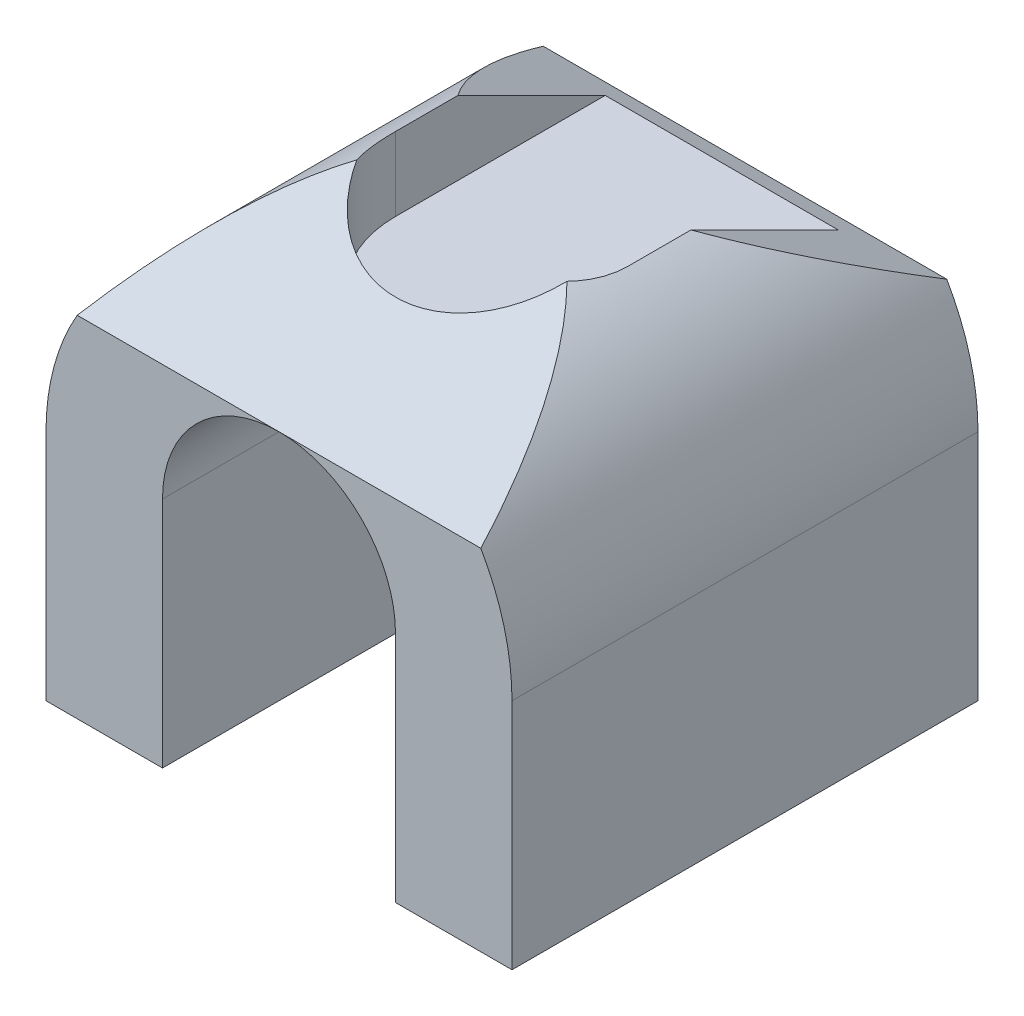
from build123d import *

# Parameters (mm, degrees)
SKETCH1_W           = 4
SKETCH1_H           = 4
BOSS_EXTRUDE1_DEPTH = 4
CUT_EXTRUDE1_DEPTH  = 10
CUT_EXTRUDE2_DEPTH  = 10
CUT_EXTRUDE5_DEPTH  = 0.9


with BuildPart() as part:
    # Sketch1 → Boss-Extrude1 (new body)
    with BuildSketch(Plane(origin=(0, 0, 0), x_dir=(1, 0, 0), z_dir=(0, 1, 0))):
        Rectangle(SKETCH1_W, SKETCH1_H)
    extrude(amount=BOSS_EXTRUDE1_DEPTH)

    # Sketch4 → Cut-Extrude1 (cut)
    with BuildSketch(Plane.ZY.offset(2)):
        Polygon((-2, 4), (-2, 3), (0, 4), align=None)
        Polygon((2, 4), (0, 4), (2, 3), align=None)
    extrude(amount=-CUT_EXTRUDE1_DEPTH, mode=Mode.SUBTRACT)

    # Sketch5 → Cut-Extrude2 (cut)
    with BuildSketch(Plane.XY.offset(2)):
        with BuildLine():
            Line((2, 4), (0, 4))
            ThreePointArc((0, 4), (1.414213562, 3.414213562), (2, 2))
            Line((2, 2), (2, 4))
        make_face()
        with BuildLine():
            Line((0, 4), (-2, 4))
            Line((-2, 4), (-2, 2))
            ThreePointArc((-2, 2), (-1.414213562, 3.414213562), (0, 4))
        make_face()
        with BuildLine():
            ThreePointArc((1, 2), (0, 3), (-1, 2))
            Line((-1, 2), (-1, 0))
            Line((-1, 0), (1, 0))
            Line((1, 0), (1, 2))
        make_face()
    extrude(amount=-CUT_EXTRUDE2_DEPTH, mode=Mode.SUBTRACT)

    # Sketch6 → Cut-Extrude5 (cut)
    with BuildSketch(Plane(origin=(0, 4, 0), x_dir=(1, 0, 0), z_dir=(0, 1, 0))):
        with BuildLine():
            Line((-1, 0), (-1, 2))
            ThreePointArc((-1, 2), (0, 3), (1, 2))
            Line((1, 2), (1, 0))
            ThreePointArc((1, 0), (0, -1), (-1, 0))
        make_face()
    extrude(amount=-CUT_EXTRUDE5_DEPTH, mode=Mode.SUBTRACT)


solid = part.part
